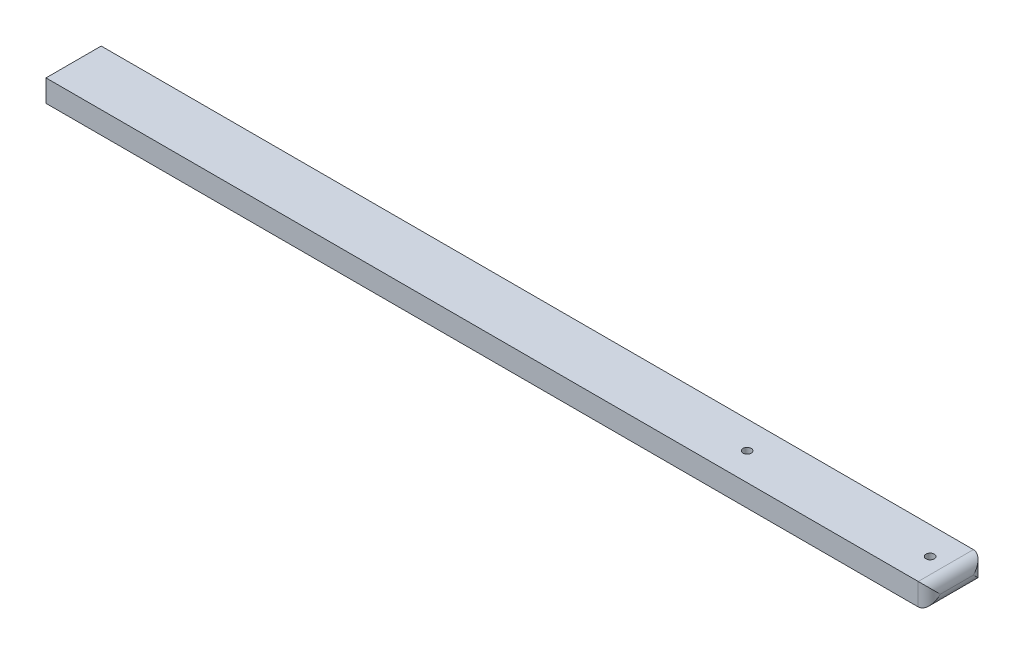
from build123d import *

# Parameters (mm, degrees)
SKETCH_2_W          = 160
SKETCH_2_H          = 10
EXTRUDE_1_DEPTH     = 4
SKETCH_3_R          = 0.75
CUT_EXTRUDE_1_DEPTH = 14
FILLET_1_R          = 2


with BuildPart() as part:
    # Эскиз2 → Бобышка-Вытянуть1 (new body)
    with BuildSketch(Plane(origin=(0, 0, 0), x_dir=(1, 0, 0), z_dir=(0, 1, 0))):
        Rectangle(SKETCH_2_W, SKETCH_2_H)
    extrude(amount=EXTRUDE_1_DEPTH)

    # Эскиз3 → Вырез-Вытянуть1 (cut)
    with BuildSketch(Plane(origin=(0, 4, 0), x_dir=(1, 0, 0), z_dir=(0, 1, 0))):
        with Locations(Location((75.16, 0, 0), (0, 0, 270))):
            Circle(SKETCH_3_R)
        with Locations(Location((42, 0, 0), (0, 0, 270))):
            Circle(SKETCH_3_R)
    extrude(amount=-CUT_EXTRUDE_1_DEPTH, mode=Mode.SUBTRACT)

    # Скругление1
    fillet_1_edges = [part.edges().sort_by_distance(p)[0] for p in [
        (80, 4, 0),
        (80, 0, 0),
        (80, 2, 5),
        (80, 2, -5),
    ]]
    fillet(fillet_1_edges, radius=FILLET_1_R - 0.0001)  # a hair under: the kernel refuses the full size


solid = part.part
